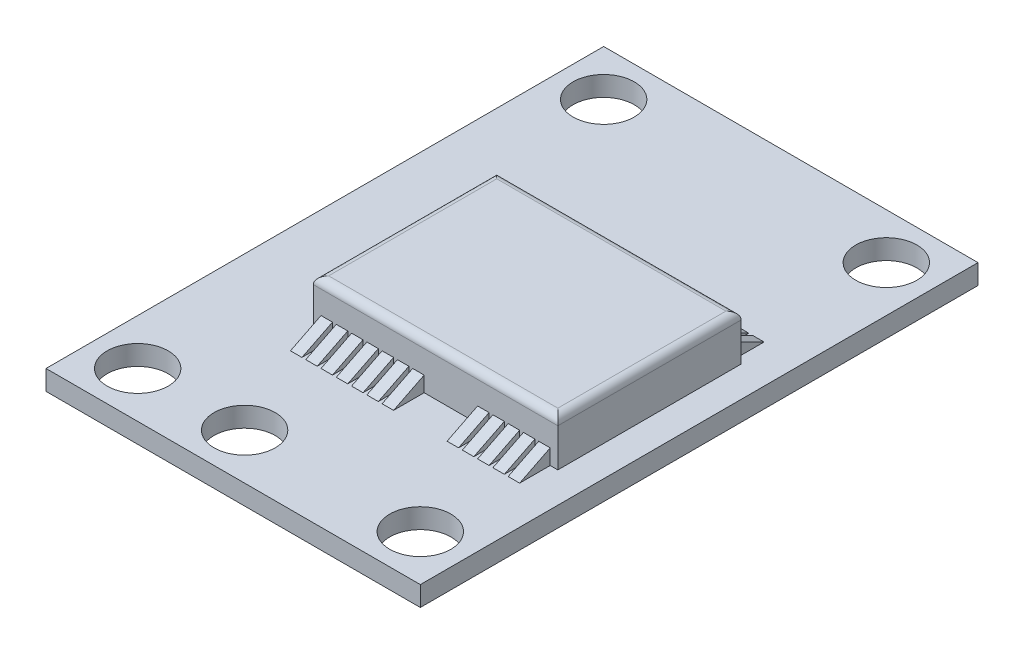
from build123d import *

# Parameters (mm, degrees)
CROQUIS1_W              = 24.5
CROQUIS1_H              = 36.5
CROQUIS1_R              = 2
SALIENTE_EXTRUIR1_DEPTH = 1.3
CROQUIS2_W              = 16
CROQUIS2_H              = 12
SALIENTE_EXTRUIR2_DEPTH = 3
REDONDEO1_R             = 0.5
CARTELA1_START          = 9
CARTELA1_DEPTH          = 0.75
MATRIZL5_COUNT          = 5
MATRIZL5_PITCH          = 1
CARTELA2_START          = -5.25
CARTELA2_DEPTH          = 0.75
MATRIZL6_COUNT          = 7
MATRIZL6_PITCH          = 1


# Read off the part's stored shape, not the designer's step: Cartela1, Cartela2
with BuildPart() as part:
    # Croquis1 → Saliente-Extruir1 (new body)
    with BuildSketch(Plane(origin=(0, 0, 0), x_dir=(1, 0, 0), z_dir=(0, 1, 0))):
        Rectangle(CROQUIS1_W, CROQUIS1_H)
        with Locations(Location((-9.25, 15.25, 0), (0, 0, 270))):
            Circle(CROQUIS1_R, mode=Mode.SUBTRACT)
        with Locations(Location((9.25, 15.25, 0), (0, 0, 270))):
            Circle(CROQUIS1_R, mode=Mode.SUBTRACT)
        with Locations(Location((9.25, -15.25, 0), (0, 0, 270))):
            Circle(CROQUIS1_R, mode=Mode.SUBTRACT)
        with Locations(Location((-9.25, -15.25, 0), (0, 0, 270))):
            Circle(CROQUIS1_R, mode=Mode.SUBTRACT)
        with Locations(Location((-2.25, -15.25, 0), (0, 0, 270))):
            Circle(CROQUIS1_R, mode=Mode.SUBTRACT)
    extrude(amount=SALIENTE_EXTRUIR1_DEPTH)

    # Croquis2 → Saliente-Extruir2 (add)
    with BuildSketch(Plane(origin=(0, 1.3, 0), x_dir=(1, 0, 0), z_dir=(0, 1, 0))):
        with Locations((2.25, -1.25)):
            Rectangle(CROQUIS2_W, CROQUIS2_H)
    extrude(amount=SALIENTE_EXTRUIR2_DEPTH)

    # Redondeo1
    redondeo1_edges = [part.edges().sort_by_distance(p)[0] for p in [
        (-5.75, 4.3, 1.25),
        (2.25, 4.3, 7.25),
        (10.25, 4.3, 1.25),
        (2.25, 4.3, -4.75),
    ]]
    fillet(redondeo1_edges, radius=REDONDEO1_R)


with BuildPart() as body_2:
    # Cartela1 outline → Cartela1 (new body)
    with BuildSketch(Plane.YZ.offset(CARTELA1_START)):
        Polygon((2.3, 7.25), (1.3, 9.25), (1.3, 7.25), align=None)
    extrude(amount=CARTELA1_DEPTH)


with BuildPart() as matrizl5_1:
    # MatrizL5: pattern copy
    add(body_2.part.moved(Location(Vector(-1, 0, 0) * (1 * MATRIZL5_PITCH))))


with BuildPart() as matrizl5_2:
    # MatrizL5: pattern copy
    add(body_2.part.moved(Location(Vector(-1, 0, 0) * (2 * MATRIZL5_PITCH))))


with BuildPart() as matrizl5_3:
    # MatrizL5: pattern copy
    add(body_2.part.moved(Location(Vector(-1, 0, 0) * (3 * MATRIZL5_PITCH))))


with BuildPart() as matrizl5_4:
    # MatrizL5: pattern copy
    add(body_2.part.moved(Location(Vector(-1, 0, 0) * (4 * MATRIZL5_PITCH))))


with BuildPart() as body_7:
    # Cartela2 outline → Cartela2 (new body)
    with BuildSketch(Plane.YZ.offset(CARTELA2_START)):
        Polygon((2.3, 7.25), (1.3, 9.25), (1.3, 7.25), align=None)
    extrude(amount=CARTELA2_DEPTH)


with BuildPart() as matrizl6_1:
    # MatrizL6: pattern copy
    add(body_7.part.moved(Location(Vector(1, 0, 0) * (1 * MATRIZL6_PITCH))))


with BuildPart() as matrizl6_2:
    # MatrizL6: pattern copy
    add(body_7.part.moved(Location(Vector(1, 0, 0) * (2 * MATRIZL6_PITCH))))


with BuildPart() as matrizl6_3:
    # MatrizL6: pattern copy
    add(body_7.part.moved(Location(Vector(1, 0, 0) * (3 * MATRIZL6_PITCH))))


with BuildPart() as matrizl6_4:
    # MatrizL6: pattern copy
    add(body_7.part.moved(Location(Vector(1, 0, 0) * (4 * MATRIZL6_PITCH))))


with BuildPart() as matrizl6_5:
    # MatrizL6: pattern copy
    add(body_7.part.moved(Location(Vector(1, 0, 0) * (5 * MATRIZL6_PITCH))))


with BuildPart() as matrizl6_6:
    # MatrizL6: pattern copy
    add(body_7.part.moved(Location(Vector(1, 0, 0) * (6 * MATRIZL6_PITCH))))


with BuildPart() as body_14:
    # Simetría1: mirrored copy
    add(body_7.part.mirror(Plane.XY.offset(1.25)))


with BuildPart() as body_15:
    # Simetr_a1 2: mirrored copy
    add(matrizl6_1.part.mirror(Plane.XY.offset(1.25)))


with BuildPart() as body_16:
    # Simetr_a1 3: mirrored copy
    add(matrizl6_2.part.mirror(Plane.XY.offset(1.25)))


with BuildPart() as body_17:
    # Simetr_a1 4: mirrored copy
    add(matrizl6_3.part.mirror(Plane.XY.offset(1.25)))


with BuildPart() as body_18:
    # Simetr_a1 5: mirrored copy
    add(matrizl6_4.part.mirror(Plane.XY.offset(1.25)))


with BuildPart() as body_19:
    # Simetr_a1 6: mirrored copy
    add(matrizl6_5.part.mirror(Plane.XY.offset(1.25)))


with BuildPart() as body_20:
    # Simetr_a1 7: mirrored copy
    add(matrizl6_6.part.mirror(Plane.XY.offset(1.25)))


with BuildPart() as body_21:
    # Simetr_a1 8: mirrored copy
    add(matrizl5_4.part.mirror(Plane.XY.offset(1.25)))


with BuildPart() as body_22:
    # Simetr_a1 9: mirrored copy
    add(matrizl5_3.part.mirror(Plane.XY.offset(1.25)))


with BuildPart() as body_23:
    # Simetr_a1 10: mirrored copy
    add(matrizl5_1.part.mirror(Plane.XY.offset(1.25)))


with BuildPart() as body_24:
    # Simetr_a1 11: mirrored copy
    add(matrizl5_2.part.mirror(Plane.XY.offset(1.25)))


with BuildPart() as body_25:
    # Simetr_a1 12: mirrored copy
    add(body_2.part.mirror(Plane.XY.offset(1.25)))


solid = Compound([part.part, body_2.part, matrizl5_1.part, matrizl5_2.part, matrizl5_3.part, matrizl5_4.part, body_7.part, matrizl6_1.part, matrizl6_2.part, matrizl6_3.part, matrizl6_4.part, matrizl6_5.part, matrizl6_6.part, body_14.part, body_15.part, body_16.part, body_17.part, body_18.part, body_19.part, body_20.part, body_21.part, body_22.part, body_23.part, body_24.part, body_25.part])
